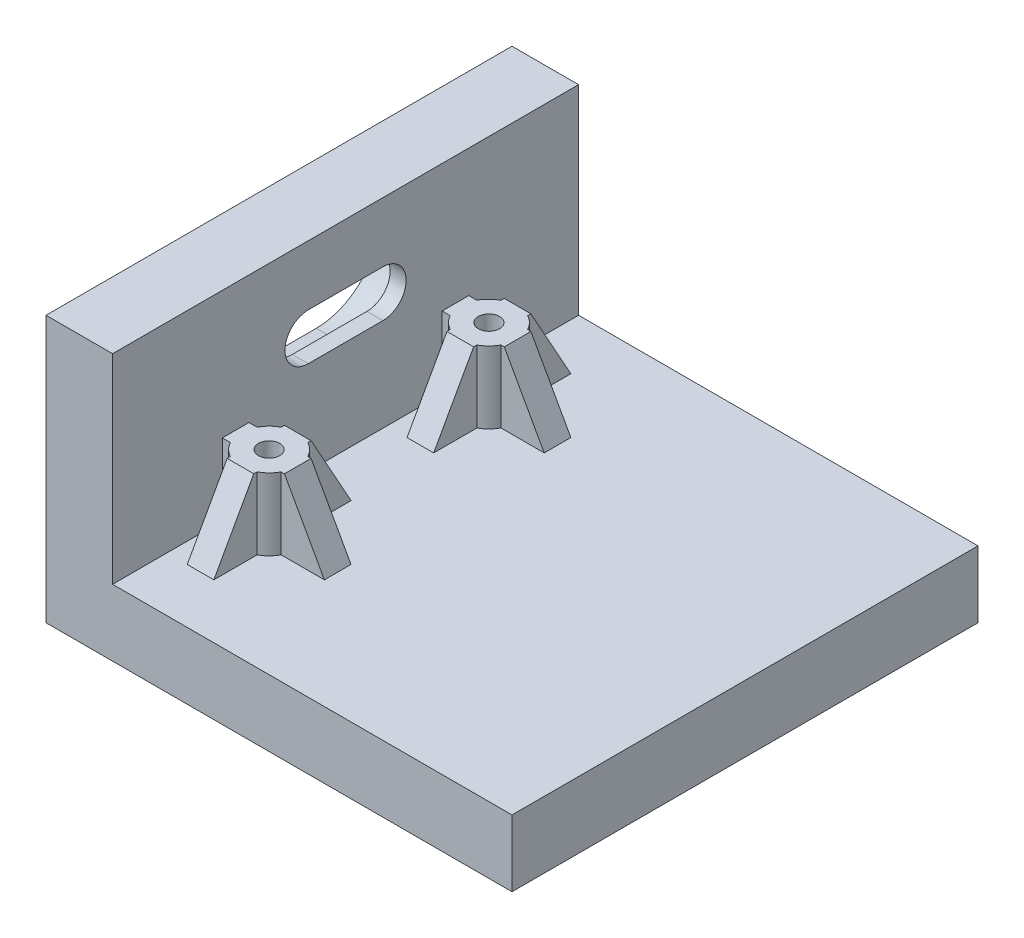
from build123d import *

# Parameters (mm, degrees)
SKETCH1_W             = 30
SKETCH1_H             = 35
BOSS_EXTRUDE1_DEPTH   = 5
SKETCH1_3_W           = 5
SKETCH1_3_H           = 35
BOSS_EXTRUDE2_DEPTH   = 20
CUT_EXTRUDE1_DEPTH    = 5
CUT_EXTRUDE2_DEPTH    = 3.8
SKETCH3_R             = 2.151
BOSS_EXTRUDE3_DEPTH   = 5.4
RIB1_START            = -1
RIB1_DEPTH            = 2
CIRPATTERN6_COUNT     = 4
SKETCH6_W             = 5.4
SKETCH6_H             = 0.862
BOSS_EXTRUDE4_DEPTH   = 1
MIRROR1_START         = -1
MIRROR1_COPY_1_DEPTH  = 2
MIRROR1_COPY_2_DEPTH  = 2
M2_TAPPED_HOLE1_D     = 1.6
M2_TAPPED_HOLE1_DEPTH = 5.4
M2_TAPPED_HOLE1_TIP   = 0.480688495


with BuildPart() as part:
    # Sketch1 → Boss-Extrude1 (new body)
    with BuildSketch(Plane(origin=(0, 0, 0), x_dir=(1, 0, 0), z_dir=(0, 1, 0))):
        with Locations((20, 17.5)):
            Rectangle(SKETCH1_W, SKETCH1_H)
    extrude(amount=BOSS_EXTRUDE1_DEPTH)

    # Sketch1<3> → Boss-Extrude2 (add)
    with BuildSketch(Plane(origin=(0, 0, 0), x_dir=(1, 0, 0), z_dir=(0, 1, 0))):
        with Locations((2.5, 17.5)):
            Rectangle(SKETCH1_3_W, SKETCH1_3_H)
    extrude(amount=BOSS_EXTRUDE2_DEPTH)

    # Sketch2 → Cut-Extrude1 (cut)
    with BuildSketch(Plane.ZY):
        with BuildLine():
            Line((-20.3, 12), (-14.7, 12))
            ThreePointArc((-14.7, 12), (-12.95, 13.75), (-14.7, 15.5))
            Line((-14.7, 15.5), (-20.3, 15.5))
            ThreePointArc((-20.3, 15.5), (-22.05, 13.75), (-20.3, 12))
        make_face()
    extrude(amount=-CUT_EXTRUDE1_DEPTH, mode=Mode.SUBTRACT)

    # Sketch2<4> → Cut-Extrude2 (cut)
    with BuildSketch(Plane.ZY):
        with BuildLine():
            Line((-20.3, 18.5), (-14.7, 18.5))
            ThreePointArc((-14.7, 18.5), (-9.95, 13.75), (-14.7, 9))
            Line((-14.7, 9), (-20.3, 9))
            ThreePointArc((-20.3, 9), (-25.05, 13.75), (-20.3, 18.5))
        make_face()
        with BuildLine():
            ThreePointArc((-14.7, 12), (-12.95, 13.75), (-14.7, 15.5))
            Line((-14.7, 15.5), (-20.3, 15.5))
            ThreePointArc((-20.3, 15.5), (-22.05, 13.75), (-20.3, 12))
            Line((-20.3, 12), (-14.7, 12))
        make_face(mode=Mode.SUBTRACT)
    extrude(amount=-CUT_EXTRUDE2_DEPTH, mode=Mode.SUBTRACT)

    # Sketch3 → Boss-Extrude3 (add)
    with BuildSketch(Plane(origin=(0, 5, 0), x_dir=(1, 0, 0), z_dir=(0, 1, 0))):
        with Locations(Location((7.513, 25.755, 0), (0, 0, 90))):
            Circle(SKETCH3_R)
        with Locations(Location((7.513, 9.245, 0), (0, 0, 90))):
            Circle(SKETCH3_R)
    extrude(amount=BOSS_EXTRUDE3_DEPTH)

    # Rib1: read off the stored shape, not the designer's step
    # Rib1 outline → Rib1 (add)
    with BuildSketch(Plane(origin=(7.513, 0, 0), x_dir=(0, 0, -1), z_dir=(1, 0, 0)).offset(RIB1_START)):
        Polygon((7.094, 10.4), (4.094, 5), (7.340583816, 5), (7.340583816, 10.4), align=None)
    rib1 = extrude(amount=RIB1_DEPTH)

    # CirPattern6: Rib1 ×4 about axis, 1 skipped
    cirpattern6_axis = Axis((7.513, 0, -9.245), (0, 1, 0))
    add([rib1.rotate(cirpattern6_axis, i * 360 / CIRPATTERN6_COUNT) for i in range(1, CIRPATTERN6_COUNT) if i not in (3,)])

    # Sketch6 → Boss-Extrude4 (add, symmetric)
    with BuildSketch(Plane(origin=(0, 0, -9.245), x_dir=(0, -1, 0), z_dir=(0, 0, 1))):
        with Locations((-7.7, 5.431)):
            Rectangle(SKETCH6_W, SKETCH6_H)
    boss_extrude4 = extrude(amount=BOSS_EXTRUDE4_DEPTH, both=True)

    # Mirror1: Rib1, Boss-Extrude4 across plane
    add(rib1.mirror(Plane.XY.offset(-17.5)))
    add(boss_extrude4.mirror(Plane.XY.offset(-17.5)))

    # Mirror1 copy 1 sketch → Mirror1 copy 1 (add)
    with BuildSketch(Plane(origin=(16.758, 0, -25.755), x_dir=(-1, 0, 0), z_dir=(0, 0, 1)).offset(MIRROR1_START)):
        Polygon((7.094, -10.4), (4.094, -5), (7.340583816, -5), (7.340583816, -10.4), align=None)
    extrude(amount=MIRROR1_COPY_1_DEPTH)

    # Mirror1 copy 2 sketch → Mirror1 copy 2 (add)
    with BuildSketch(Plane(origin=(7.513, 0, -16.51), x_dir=(0, 0, -1), z_dir=(-1, 0, 0)).offset(MIRROR1_START)):
        Polygon((7.094, -10.4), (4.094, -5), (7.340583816, -5), (7.340583816, -10.4), align=None)
    extrude(amount=MIRROR1_COPY_2_DEPTH)

    # M2 Tapped Hole1
    with Locations(Plane(origin=(0, 10.4, 0), x_dir=(1, 0, 0), z_dir=(0, 1, 0))):
        with Locations((7.513, 9.245), (7.513, 25.755)):
            Hole(M2_TAPPED_HOLE1_D / 2, depth=M2_TAPPED_HOLE1_DEPTH)
            with Locations((0, 0, -(M2_TAPPED_HOLE1_DEPTH + M2_TAPPED_HOLE1_TIP / 2))):  # 118° drill point
                Cone(0, M2_TAPPED_HOLE1_D / 2, M2_TAPPED_HOLE1_TIP, mode=Mode.SUBTRACT)


solid = part.part
